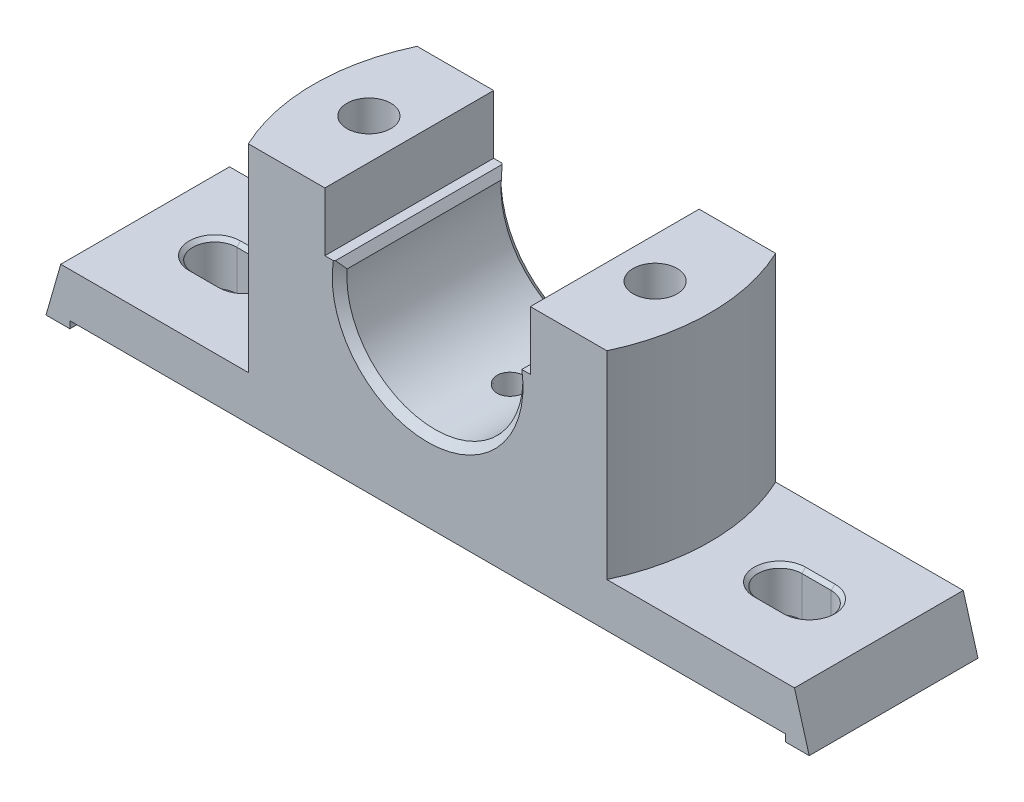
from build123d import *

# Parameters (mm, degrees)
BOSS_EXTRUDE1_DEPTH      = 23
BOSS_EXTRUDE2_DEPTH      = 54
BOSS_EXTRUDE3_DEPTH      = 23
CUT_EXTRUDE1_DEPTH       = 12
CHAMFER1_SIZE            = 1
CHAMFER1_OF_MIRROR2_SIZE = 1
SKETCH7_W                = 28
SKETCH7_H                = 28
CUT_EXTRUDE2_DEPTH       = 10
F_12_0MM_DOWEL_HOLE1_D   = 12
CUT_EXTRUDE3_START       = 1.999999915
CUT_EXTRUDE3_DEPTH       = 36.000000085
CUT_EXTRUDE3_START_2     = -5
CUT_EXTRUDE3_2_DEPTH     = 10
CHAMFER2_START           = -23
CHAMFER2_2_DEPTH         = 46


with BuildPart() as part:
    # Sketch2 → Boss-Extrude1 (new, symmetric)
    with BuildSketch(Plane.XY):
        Polygon((99.985564599, 0), (-99.985564599, 0), (-104, -14), (-97.5, -14), (-97.5, -12.082323829), (97.5, -12.082323829), (97.5, -14), (104, -14), align=None)
    extrude(amount=BOSS_EXTRUDE1_DEPTH, both=True)

    # Sketch3 → Boss-Extrude2 (add)
    with BuildSketch(Plane(origin=(0, 0, 0), x_dir=(1, 0, 0), z_dir=(0, 1, 0))):
        with BuildLine():
            Line((48.856934001, -23), (28, -23))
            Line((28, -23), (28, 23))
            Line((28, 23), (48.856934001, 23))
            ThreePointArc((48.856934001, 23), (54, 0), (48.856934001, -23))
        make_face()
    boss_extrude2 = extrude(amount=BOSS_EXTRUDE2_DEPTH)

    # Mirror1: Boss-Extrude2 across plane
    add(boss_extrude2.mirror(Plane(origin=(0, 0, 0), x_dir=(0, 0, 1), z_dir=(1, 0, 0))))

    # Sketch4 → Boss-Extrude3 (add, symmetric)
    with BuildSketch(Plane.XY):
        with BuildLine():
            Line((-28, 38), (-23.664319132, 38))
            ThreePointArc((-23.664319132, 38), (0, 10), (23.664319132, 38))
            Line((23.664319132, 38), (28, 38))
            Line((28, 38), (28, 0))
            Line((28, 0), (-28, 0))
            Line((-28, 0), (-28, 38))
        make_face()
    extrude(amount=BOSS_EXTRUDE3_DEPTH, both=True)

    # Sketch5 → Cut-Extrude1 (cut)
    with BuildSketch(Plane(origin=(0, 0, 0), x_dir=(1, 0, 0), z_dir=(0, 1, 0))):
        with BuildLine():
            Line((-81, 6), (-73, 6))
            ThreePointArc((-73, 6), (-67, 0), (-73, -6))
            Line((-73, -6), (-81, -6))
            ThreePointArc((-81, -6), (-87, 0), (-81, 6))
        make_face()
    cut_extrude1 = extrude(amount=-CUT_EXTRUDE1_DEPTH, mode=Mode.SUBTRACT)

    # Chamfer1
    chamfer1_edges = [part.edges().sort_by_distance(p)[0] for p in [
        (-87, 0, 0),
        (-77, 0, 6),
        (-67, 0, 0),
        (-77, 0, -6),
    ]]
    chamfer(chamfer1_edges, length=CHAMFER1_SIZE)

    # Mirror2: Cut-Extrude1 across plane
    add(cut_extrude1.mirror(Plane(origin=(0, 0, 0), x_dir=(0, 0, 1), z_dir=(1, 0, 0))), mode=Mode.SUBTRACT)

    # Chamfer1 of Mirror2
    chamfer1_of_mirror2_edges = [part.edges().sort_by_distance(p)[0] for p in [
        (87, 0, 0),
        (77, 0, 6),
        (67, 0, 0),
        (77, 0, -6),
    ]]
    chamfer(chamfer1_of_mirror2_edges, length=CHAMFER1_OF_MIRROR2_SIZE)

    # Sketch7 → Cut-Extrude2 (cut)
    with BuildSketch(Plane.XZ.offset(12.082323829)):
        with Locations((-39, 0)):
            Rectangle(SKETCH7_W, SKETCH7_H)
    cut_extrude2 = extrude(amount=-CUT_EXTRUDE2_DEPTH, mode=Mode.SUBTRACT)

    # Mirror3: Cut-Extrude2 across plane
    add(cut_extrude2.mirror(Plane(origin=(0, 0, 0), x_dir=(0, 0, 1), z_dir=(1, 0, 0))), mode=Mode.SUBTRACT)

    # Ø12.0mm Dowel Hole1 (through all)
    with Locations(Plane(origin=(0, -2.082323829, 0), x_dir=(-1, 0, 0), z_dir=(0, -1, 0))):
        with Locations((39, 0), (-39, 0)):
            Hole(F_12_0MM_DOWEL_HOLE1_D / 2)

    # Cut-Extrude3: read off the stored shape, not the designer's step
    # Cut-Extrude3 outline → Cut-Extrude3 (cut)
    with BuildSketch(Plane(origin=(0, 0, 0), x_dir=(1, 0, 0), z_dir=(0, 1, 0)).offset(CUT_EXTRUDE3_START)):
        with BuildLine():
            add(Edge.make_bspline(
                [(4, 0), (4, 1.059018663), (3.564754015, 2.092267125), (2.091459192, 3.565228094), (1.047779124, 3.999399314), (-1.043187737, 4.000599369), (-2.08248981, 3.57393755), (-3.572744195, 2.08453648), (-3.999590121, 1.046654427), (-4.000409264, -1.043519212), (-3.567812098, -2.087662609), (-2.094321457, -3.563907402), (-1.060428453, -3.999150693), (1.054011474, -4.000846733), (2.089559005, -3.5661873), (3.563043078, -2.094915922), (4, -1.059018663), (4, 0)],
                knots=[0, 0, 0, 0, 0.125, 0.125, 0.25, 0.25, 0.375, 0.375, 0.5, 0.5, 0.625, 0.625, 0.75, 0.75, 0.875, 0.875, 1, 1, 1, 1], degree=3))
        make_face()
    extrude(amount=CUT_EXTRUDE3_DEPTH, mode=Mode.SUBTRACT)

    # Cut-Extrude3 2 outline → Cut-Extrude3 2 (add)
    with BuildSketch(Plane.XY.offset(CUT_EXTRUDE3_START_2)):
        with BuildLine():
            Line((5, 2.504711719), (4, 2.335680868))
            ThreePointArc((4, 2.335680868), (2.007030354, 2.084067462), (2.16e-07, 2))
            Line((2.16e-07, 2), (5, 1.999999915))
            Line((5, 1.999999915), (5, 2.504711719))
        make_face()
        with BuildLine():
            Line((-5, 1.999999915), (2.16e-07, 2))
            ThreePointArc((2.16e-07, 2), (-2.014229388, 2.084672698), (-4.014246469, 2.338093372))
            Line((-4.014246469, 2.338093372), (-5, 2.505326626))
            Line((-5, 2.505326626), (-5, 1.999999915))
        make_face()
    extrude(amount=CUT_EXTRUDE3_2_DEPTH)

    # Chamfer2: read off the stored shape, not the designer's step
    # Chamfer2 outline → Chamfer2 (revolve, cut)
    with BuildSketch(Plane.XZ.offset(-34)):
        Polygon((24, 23), (24, 21), (26, 23), align=None)
        Polygon((26, -23), (24, -21), (24, -23), align=None)
    revolve(axis=Axis((0, 34, 0), (0, 0, 1)), mode=Mode.SUBTRACT)

    # Chamfer2 2 outline → Chamfer2 2 (cut)
    with BuildSketch(Plane.XY.offset(CHAMFER2_START)):
        with BuildLine():
            ThreePointArc((23.664319132, 38), (23.796597884, 37.118000823), (23.896015012, 36.231695881))
            Line((23.896015012, 36.231695881), (25.664319132, 38))
            Line((25.664319132, 38), (23.664319132, 38))
        make_face()
        with BuildLine():
            Line((-25.399406115, 38), (-23.922856044, 35.922747689))
            ThreePointArc((-23.922856044, 35.922747689), (-23.816245603, 36.964193884), (-23.664319132, 38))
            Line((-23.664319132, 38), (-25.399406115, 38))
        make_face()
    extrude(amount=CHAMFER2_2_DEPTH, mode=Mode.SUBTRACT)


solid = part.part
